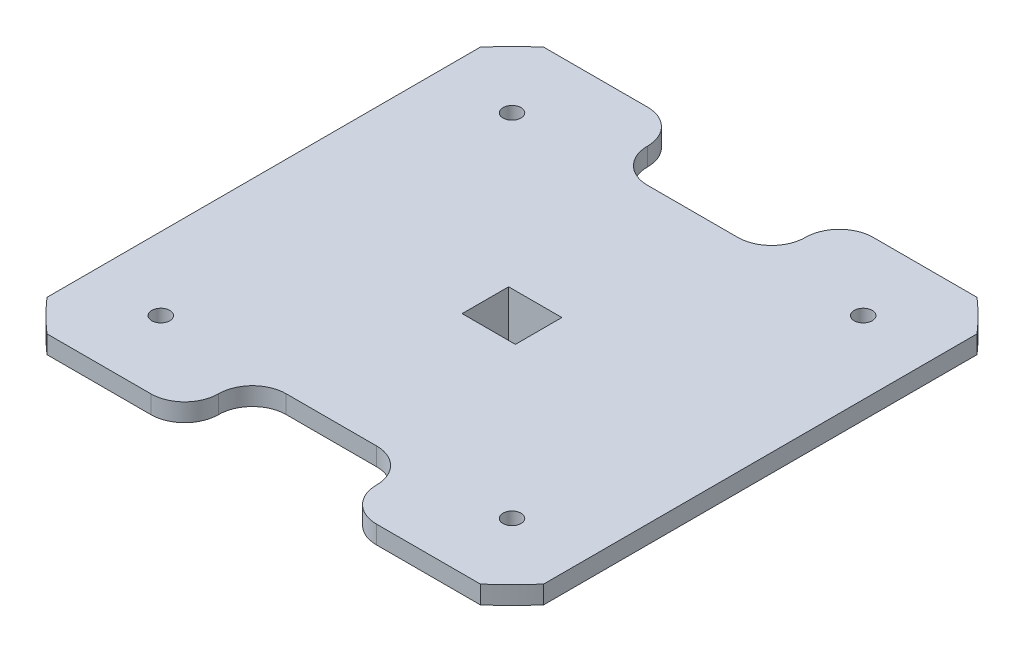
from build123d import *

# Parameters (mm, degrees)
BOSS_EXTRUDE1_DEPTH      = 4
F_4_0MM_DOWEL_HOLE2_D    = 4
FILLET1_START            = -1
FILLET1_DEPTH            = 6
FILLET1_2_DEPTH          = 4
SKETCH7_W                = 21.8
SKETCH7_H                = 20.3
SKETCH7_W_2              = 11.8
SKETCH7_H_2              = 10.3
BOSS_EXTRUDE2_DEPTH      = 10
M3_CLEARANCE_HOLE1_D     = 3.4
M3_CLEARANCE_HOLE1_DEPTH = 5
SKETCH7_2_W              = 11.8
SKETCH7_2_H              = 10.3
CUT_EXTRUDE1_DEPTH       = 10


with BuildPart() as part:
    # Sketch1 → Boss-Extrude1 (new body)
    with BuildSketch(Plane(origin=(0, 0, 0), x_dir=(1, 0, 0), z_dir=(0, 1, 0))):
        with BuildLine():
            Line((55, 48), (55, -48))
            ThreePointArc((55, -48), (51.618795027, -51.618795027), (48, -55))
            Line((48, -55), (17.5, -55))
            Line((17.5, -55), (17.5, -40))
            Line((17.5, -40), (-17.5, -40))
            Line((-17.5, -40), (-17.5, -55))
            Line((-17.5, -55), (-48, -55))
            ThreePointArc((-48, -55), (-51.618795027, -51.618795027), (-55, -48))
            Line((-55, -48), (-55, 48))
            ThreePointArc((-55, 48), (-51.618795027, 51.618795027), (-48, 55))
            Line((-48, 55), (-17.5, 55))
            Line((-17.5, 55), (-17.5, 40))
            Line((-17.5, 40), (17.5, 40))
            Line((17.5, 40), (17.5, 55))
            Line((17.5, 55), (48, 55))
            ThreePointArc((48, 55), (51.618795027, 51.618795027), (55, 48))
        make_face()
    extrude(amount=BOSS_EXTRUDE1_DEPTH)

    # Ø4.0mm Dowel Hole2 (through all)
    with Locations(Plane(origin=(0, 4, 0), x_dir=(1, 0, 0), z_dir=(0, 1, 0))):
        with Locations((38.890872965, 38.890872965), (38.890872965, -38.890872965), (-38.890872965, -38.890872965), (-38.890872965, 38.890872965)):
            Hole(F_4_0MM_DOWEL_HOLE2_D / 2)

    # Fillet1: read off the stored shape, not the designer's step
    # Fillet1 outline → Fillet1 (cut)
    with BuildSketch(Plane(origin=(0, 0, 0), x_dir=(1, 0, 0), z_dir=(0, 1, 0)).offset(FILLET1_START)):
        with BuildLine():
            Line((17.5, 55), (17.5, 47.5))
            ThreePointArc((17.5, 47.5), (19.696699141, 52.803300859), (25, 55))
            Line((25, 55), (17.5, 55))
        make_face()
        with BuildLine():
            ThreePointArc((-25, 55), (-19.696699141, 52.803300859), (-17.5, 47.5))
            Line((-17.5, 47.5), (-17.5, 55))
            Line((-17.5, 55), (-25, 55))
        make_face()
        with BuildLine():
            Line((-17.5, -55), (-17.5, -47.5))
            ThreePointArc((-17.5, -47.5), (-19.696699141, -52.803300859), (-25, -55))
            Line((-25, -55), (-17.5, -55))
        make_face()
        with BuildLine():
            ThreePointArc((25, -55), (19.696699141, -52.803300859), (17.5, -47.5))
            Line((17.5, -47.5), (17.5, -55))
            Line((17.5, -55), (25, -55))
        make_face()
    extrude(amount=FILLET1_DEPTH, mode=Mode.SUBTRACT)

    # Fillet1 2 outline → Fillet1 2 (add)
    with BuildSketch(Plane(origin=(0, 0, 0), x_dir=(1, 0, 0), z_dir=(0, 1, 0))):
        with BuildLine():
            Line((-17.5, 40), (-10, 40))
            ThreePointArc((-10, 40), (-15.303300859, 42.196699141), (-17.5, 47.5))
            Line((-17.5, 47.5), (-17.5, 40))
        make_face()
        with BuildLine():
            ThreePointArc((17.5, 47.5), (15.303300859, 42.196699141), (10, 40))
            Line((10, 40), (17.5, 40))
            Line((17.5, 40), (17.5, 47.5))
        make_face()
        with BuildLine():
            Line((17.5, -40), (10, -40))
            ThreePointArc((10, -40), (15.303300859, -42.196699141), (17.5, -47.5))
            Line((17.5, -47.5), (17.5, -40))
        make_face()
        with BuildLine():
            ThreePointArc((-17.5, -47.5), (-15.303300859, -42.196699141), (-10, -40))
            Line((-10, -40), (-17.5, -40))
            Line((-17.5, -40), (-17.5, -47.5))
        make_face()
    extrude(amount=FILLET1_2_DEPTH)

    # Sketch7 → Boss-Extrude2 (add)
    with BuildSketch(Plane.XZ):
        Rectangle(SKETCH7_W, SKETCH7_H)
        Rectangle(SKETCH7_W_2, SKETCH7_H_2, mode=Mode.SUBTRACT)
    extrude(amount=BOSS_EXTRUDE2_DEPTH)

    # M3 Clearance Hole1
    with Locations(Plane(origin=(0, -5, -10.15), x_dir=(-1, 0, 0), z_dir=(0, 0, -1))):
        with Locations((0, 0)):
            Hole(M3_CLEARANCE_HOLE1_D / 2, depth=M3_CLEARANCE_HOLE1_DEPTH)

    # Sketch7<2> → Cut-Extrude1 (cut)
    with BuildSketch(Plane.XZ):
        Rectangle(SKETCH7_2_W, SKETCH7_2_H)
    extrude(amount=-CUT_EXTRUDE1_DEPTH, mode=Mode.SUBTRACT)


solid = part.part
